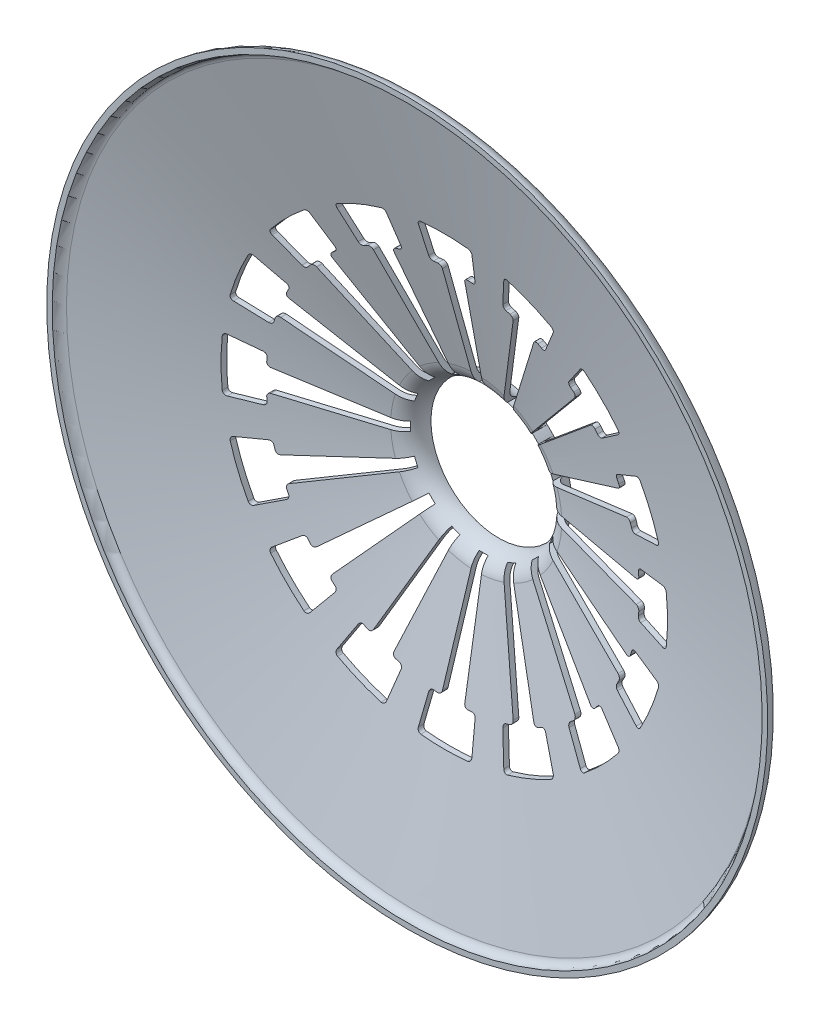
from build123d import *

# Parameters (mm, degrees)
CUT_EXTRUDE1_DEPTH = 142.525616125


with BuildPart() as part:
    # Sketch1 → Revolve4 (revolve)
    with BuildSketch(Plane(origin=(0, 0, 0), x_dir=(0, 0, -1), z_dir=(1, 0, 0))):
        with BuildLine():
            Line((0, 98.5), (0, 97))
            ThreePointArc((0, 97), (1.387336697, 96.516005618), (2.172558759, 95.2740797))
            Line((2.172558759, 95.2740797), (18.866887493, 23.372256429))
            ThreePointArc((18.866887493, 23.372256429), (21.083561831, 19.866311491), (25, 18.5))
            Line((25, 18.5), (25, 20))
            ThreePointArc((25, 20), (22.016601538, 21.04080581), (20.328020607, 23.711505636))
            Line((20.328020607, 23.711505636), (3.633691873, 95.613328906))
            ThreePointArc((3.633691873, 95.613328906), (2.320376404, 97.690499937), (0, 98.5))
        make_face()
    revolve(axis=Axis((0, 0, -25), (0, 0, 1)))

    # Sketch2 → Cut-Extrude1 (cut, through all)
    with BuildSketch(Plane(origin=(0, 0, -25), x_dir=(-1, 0, 0), z_dir=(0, 0, -1))):
        with BuildLine():
            Line((0, 0), (-49.896757575, 3.05181643))
            ThreePointArc((-49.896757575, 3.05181643), (-50.591253835, 3.394854247), (-50.832423216, 4.130950253))
            ThreePointArc((-50.832423216, 4.130950253), (-50.784252364, 4.686119062), (-50.73001839, 5.240728396))
            ThreePointArc((-50.73001839, 5.240728396), (-50.942670407, 5.966698165), (-51.60285529, 6.336033928))
            Line((-51.60285529, 6.336033928), (-59.544497306, 7.311144956))
            ThreePointArc((-59.544497306, 7.311144956), (-60.28857373, 7.101451504), (-60.660806094, 6.423908784))
            ThreePointArc((-60.660806094, 6.423908784), (-61, 0), (-60.660806094, -6.423908784))
            ThreePointArc((-60.660806094, -6.423908784), (-60.28857373, -7.101451504), (-59.544497306, -7.311144956))
            Line((-59.544497306, -7.311144956), (-51.60285529, -6.336033928))
            ThreePointArc((-51.60285529, -6.336033928), (-50.942670407, -5.966698165), (-50.73001839, -5.240728396))
            ThreePointArc((-50.73001839, -5.240728396), (-50.784252364, -4.686119062), (-50.832423216, -4.130950253))
            ThreePointArc((-50.832423216, -4.130950253), (-50.591253835, -3.394854247), (-49.896757575, -3.05181643))
            Line((-49.896757575, -3.05181643), (0, 0))
        make_face()
        with BuildLine():
            ThreePointArc((-1.220970791, 19.962695968), (0, 20), (1.220970791, 19.962695968))
            Line((1.220970791, 19.962695968), (3.05181643, 49.896757575))
            ThreePointArc((3.05181643, 49.896757575), (3.394854247, 50.591253835), (4.130950253, 50.832423216))
            ThreePointArc((4.130950253, 50.832423216), (4.686119062, 50.784252364), (5.240728396, 50.73001839))
            ThreePointArc((5.240728396, 50.73001839), (5.966698165, 50.942670407), (6.336033928, 51.60285529))
            Line((6.336033928, 51.60285529), (7.311144956, 59.544497306))
            ThreePointArc((7.311144956, 59.544497306), (7.101451504, 60.28857373), (6.423908784, 60.660806094))
            ThreePointArc((6.423908784, 60.660806094), (0, 61), (-6.423908784, 60.660806094))
            ThreePointArc((-6.423908784, 60.660806094), (-7.101451504, 60.28857373), (-7.311144956, 59.544497306))
            Line((-7.311144956, 59.544497306), (-6.336033928, 51.60285529))
            ThreePointArc((-6.336033928, 51.60285529), (-5.966698165, 50.942670407), (-5.240728396, 50.73001839))
            ThreePointArc((-5.240728396, 50.73001839), (-4.686119062, 50.784252364), (-4.130950253, 50.832423216))
            ThreePointArc((-4.130950253, 50.832423216), (-3.394854247, 50.591253835), (-3.05181643, 49.896757575))
            Line((-3.05181643, 49.896757575), (-1.220970791, 19.962695968))
        make_face()
        with BuildLine():
            ThreePointArc((6.511363089, 18.910371512), (7.653668647, 18.47759065), (8.767422936, 17.975880926))
            Line((8.767422936, 17.975880926), (21.91417319, 44.930713476))
            ThreePointArc((21.91417319, 44.930713476), (22.49687102, 45.441069467), (23.269226581, 45.382189175))
            ThreePointArc((23.269226581, 45.382189175), (23.763701493, 45.125231206), (24.255339262, 44.862885744))
            ThreePointArc((24.255339262, 44.862885744), (25.007426276, 44.781533987), (25.601289846, 45.25012661))
            Line((25.601289846, 45.25012661), (29.541309792, 52.214088289))
            ThreePointArc((29.541309792, 52.214088289), (29.632324023, 52.981771477), (29.148803331, 53.584953713))
            ThreePointArc((29.148803331, 53.584953713), (23.343689374, 56.356651483), (17.278967641, 58.501600638))
            ThreePointArc((17.278967641, 58.501600638), (16.510552632, 58.41698715), (16.032075424, 57.809796381))
            Line((16.032075424, 57.809796381), (13.893825719, 50.099517033))
            ThreePointArc((13.893825719, 50.099517033), (13.982405654, 49.348247054), (14.571735861, 48.873965605))
            ThreePointArc((14.571735861, 48.873965605), (15.104882516, 48.71183146), (15.636225803, 48.543881619))
            ThreePointArc((15.636225803, 48.543881619), (16.22399831, 48.039378418), (16.275151716, 47.266472649))
            Line((16.275151716, 47.266472649), (6.511363089, 18.910371512))
        make_face()
        with BuildLine():
            ThreePointArc((13.252400964, 14.979114416), (14.142135624, 14.142135624), (14.979114416, 13.252400964))
            Line((14.979114416, 13.252400964), (37.440295733, 33.124375548))
            ThreePointArc((37.440295733, 33.124375548), (38.173943115, 33.372894196), (38.864974097, 33.022928223))
            ThreePointArc((38.864974097, 33.022928223), (39.22347579, 32.596302658), (39.577294601, 32.165785426))
            ThreePointArc((39.577294601, 32.165785426), (40.24100043, 31.802814963), (40.96898146, 32.008476348))
            Line((40.96898146, 32.008476348), (47.274078004, 36.934557651))
            ThreePointArc((47.274078004, 36.934557651), (47.651943827, 37.608974798), (47.436056804, 38.351277878))
            ThreePointArc((47.436056804, 38.351277878), (43.133513652, 43.133513652), (38.351277878, 47.436056804))
            ThreePointArc((38.351277878, 47.436056804), (37.608974798, 47.651943827), (36.934557651, 47.274078004))
            Line((36.934557651, 47.274078004), (32.008476348, 40.96898146))
            ThreePointArc((32.008476348, 40.96898146), (31.802814963, 40.24100043), (32.165785426, 39.577294601))
            ThreePointArc((32.165785426, 39.577294601), (32.596302658, 39.22347579), (33.022928223, 38.864974097))
            ThreePointArc((33.022928223, 38.864974097), (33.372894196, 38.173943115), (33.124375548, 37.440295733))
            Line((33.124375548, 37.440295733), (13.252400964, 14.979114416))
        make_face()
        with BuildLine():
            ThreePointArc((17.975880926, 8.767422936), (18.47759065, 7.653668647), (18.910371512, 6.511363089))
            Line((18.910371512, 6.511363089), (47.266472649, 16.275151716))
            ThreePointArc((47.266472649, 16.275151716), (48.039378418, 16.22399831), (48.543881619, 15.636225803))
            ThreePointArc((48.543881619, 15.636225803), (48.71183146, 15.104882516), (48.873965605, 14.571735861))
            ThreePointArc((48.873965605, 14.571735861), (49.348247054, 13.982405654), (50.099517033, 13.893825719))
            Line((50.099517033, 13.893825719), (57.809796381, 16.032075424))
            ThreePointArc((57.809796381, 16.032075424), (58.41698715, 16.510552632), (58.501600638, 17.278967641))
            ThreePointArc((58.501600638, 17.278967641), (56.356651483, 23.343689374), (53.584953713, 29.148803331))
            ThreePointArc((53.584953713, 29.148803331), (52.981771477, 29.632324023), (52.214088289, 29.541309792))
            Line((52.214088289, 29.541309792), (45.25012661, 25.601289846))
            ThreePointArc((45.25012661, 25.601289846), (44.781533987, 25.007426276), (44.862885744, 24.255339262))
            ThreePointArc((44.862885744, 24.255339262), (45.125231206, 23.763701493), (45.382189175, 23.269226581))
            ThreePointArc((45.382189175, 23.269226581), (45.441069467, 22.49687102), (44.930713476, 21.91417319))
            Line((44.930713476, 21.91417319), (17.975880926, 8.767422936))
        make_face()
        with BuildLine():
            ThreePointArc((19.962695968, 1.220970791), (20, 0), (19.962695968, -1.220970791))
            Line((19.962695968, -1.220970791), (49.896757575, -3.05181643))
            ThreePointArc((49.896757575, -3.05181643), (50.591253835, -3.394854247), (50.832423216, -4.130950253))
            ThreePointArc((50.832423216, -4.130950253), (50.784252364, -4.686119062), (50.73001839, -5.240728396))
            ThreePointArc((50.73001839, -5.240728396), (50.942670407, -5.966698165), (51.60285529, -6.336033928))
            Line((51.60285529, -6.336033928), (59.544497306, -7.311144956))
            ThreePointArc((59.544497306, -7.311144956), (60.28857373, -7.101451504), (60.660806094, -6.423908784))
            ThreePointArc((60.660806094, -6.423908784), (61, 0), (60.660806094, 6.423908784))
            ThreePointArc((60.660806094, 6.423908784), (60.28857373, 7.101451504), (59.544497306, 7.311144956))
            Line((59.544497306, 7.311144956), (51.60285529, 6.336033928))
            ThreePointArc((51.60285529, 6.336033928), (50.942670407, 5.966698165), (50.73001839, 5.240728396))
            ThreePointArc((50.73001839, 5.240728396), (50.784252364, 4.686119062), (50.832423216, 4.130950253))
            ThreePointArc((50.832423216, 4.130950253), (50.591253835, 3.394854247), (49.896757575, 3.05181643))
            Line((49.896757575, 3.05181643), (19.962695968, 1.220970791))
        make_face()
        with BuildLine():
            ThreePointArc((18.910371512, -6.511363089), (18.47759065, -7.653668647), (17.975880926, -8.767422936))
            Line((17.975880926, -8.767422936), (44.930713476, -21.91417319))
            ThreePointArc((44.930713476, -21.91417319), (45.441069467, -22.49687102), (45.382189175, -23.269226581))
            ThreePointArc((45.382189175, -23.269226581), (45.125231206, -23.763701493), (44.862885744, -24.255339262))
            ThreePointArc((44.862885744, -24.255339262), (44.781533987, -25.007426276), (45.25012661, -25.601289846))
            Line((45.25012661, -25.601289846), (52.214088289, -29.541309792))
            ThreePointArc((52.214088289, -29.541309792), (52.981771477, -29.632324023), (53.584953713, -29.148803331))
            ThreePointArc((53.584953713, -29.148803331), (56.356651483, -23.343689374), (58.501600638, -17.278967641))
            ThreePointArc((58.501600638, -17.278967641), (58.41698715, -16.510552632), (57.809796381, -16.032075424))
            Line((57.809796381, -16.032075424), (50.099517033, -13.893825719))
            ThreePointArc((50.099517033, -13.893825719), (49.348247054, -13.982405654), (48.873965605, -14.571735861))
            ThreePointArc((48.873965605, -14.571735861), (48.71183146, -15.104882516), (48.543881619, -15.636225803))
            ThreePointArc((48.543881619, -15.636225803), (48.039378418, -16.22399831), (47.266472649, -16.275151716))
            Line((47.266472649, -16.275151716), (18.910371512, -6.511363089))
        make_face()
        with BuildLine():
            ThreePointArc((14.979114416, -13.252400964), (14.142135624, -14.142135624), (13.252400964, -14.979114416))
            Line((13.252400964, -14.979114416), (33.124375548, -37.440295733))
            ThreePointArc((33.124375548, -37.440295733), (33.372894196, -38.173943115), (33.022928223, -38.864974097))
            ThreePointArc((33.022928223, -38.864974097), (32.596302658, -39.22347579), (32.165785426, -39.577294601))
            ThreePointArc((32.165785426, -39.577294601), (31.802814963, -40.24100043), (32.008476348, -40.96898146))
            Line((32.008476348, -40.96898146), (36.934557651, -47.274078004))
            ThreePointArc((36.934557651, -47.274078004), (37.608974798, -47.651943827), (38.351277878, -47.436056804))
            ThreePointArc((38.351277878, -47.436056804), (43.133513652, -43.133513652), (47.436056804, -38.351277878))
            ThreePointArc((47.436056804, -38.351277878), (47.651943827, -37.608974798), (47.274078004, -36.934557651))
            Line((47.274078004, -36.934557651), (40.96898146, -32.008476348))
            ThreePointArc((40.96898146, -32.008476348), (40.24100043, -31.802814963), (39.577294601, -32.165785426))
            ThreePointArc((39.577294601, -32.165785426), (39.22347579, -32.596302658), (38.864974097, -33.022928223))
            ThreePointArc((38.864974097, -33.022928223), (38.173943115, -33.372894196), (37.440295733, -33.124375548))
            Line((37.440295733, -33.124375548), (14.979114416, -13.252400964))
        make_face()
        with BuildLine():
            ThreePointArc((8.767422936, -17.975880926), (7.653668647, -18.47759065), (6.511363089, -18.910371512))
            Line((6.511363089, -18.910371512), (16.275151716, -47.266472649))
            ThreePointArc((16.275151716, -47.266472649), (16.22399831, -48.039378418), (15.636225803, -48.543881619))
            ThreePointArc((15.636225803, -48.543881619), (15.104882516, -48.71183146), (14.571735861, -48.873965605))
            ThreePointArc((14.571735861, -48.873965605), (13.982405654, -49.348247054), (13.893825719, -50.099517033))
            Line((13.893825719, -50.099517033), (16.032075424, -57.809796381))
            ThreePointArc((16.032075424, -57.809796381), (16.510552632, -58.41698715), (17.278967641, -58.501600638))
            ThreePointArc((17.278967641, -58.501600638), (23.343689374, -56.356651483), (29.148803331, -53.584953713))
            ThreePointArc((29.148803331, -53.584953713), (29.632324023, -52.981771477), (29.541309792, -52.214088289))
            Line((29.541309792, -52.214088289), (25.601289846, -45.25012661))
            ThreePointArc((25.601289846, -45.25012661), (25.007426276, -44.781533987), (24.255339262, -44.862885744))
            ThreePointArc((24.255339262, -44.862885744), (23.763701493, -45.125231206), (23.269226581, -45.382189175))
            ThreePointArc((23.269226581, -45.382189175), (22.49687102, -45.441069467), (21.91417319, -44.930713476))
            Line((21.91417319, -44.930713476), (8.767422936, -17.975880926))
        make_face()
        with BuildLine():
            ThreePointArc((1.220970791, -19.962695968), (0, -20), (-1.220970791, -19.962695968))
            Line((-1.220970791, -19.962695968), (-3.05181643, -49.896757575))
            ThreePointArc((-3.05181643, -49.896757575), (-3.394854247, -50.591253835), (-4.130950253, -50.832423216))
            ThreePointArc((-4.130950253, -50.832423216), (-4.686119062, -50.784252364), (-5.240728396, -50.73001839))
            ThreePointArc((-5.240728396, -50.73001839), (-5.966698165, -50.942670407), (-6.336033928, -51.60285529))
            Line((-6.336033928, -51.60285529), (-7.311144956, -59.544497306))
            ThreePointArc((-7.311144956, -59.544497306), (-7.101451504, -60.28857373), (-6.423908784, -60.660806094))
            ThreePointArc((-6.423908784, -60.660806094), (0, -61), (6.423908784, -60.660806094))
            ThreePointArc((6.423908784, -60.660806094), (7.101451504, -60.28857373), (7.311144956, -59.544497306))
            Line((7.311144956, -59.544497306), (6.336033928, -51.60285529))
            ThreePointArc((6.336033928, -51.60285529), (5.966698165, -50.942670407), (5.240728396, -50.73001839))
            ThreePointArc((5.240728396, -50.73001839), (4.686119062, -50.784252364), (4.130950253, -50.832423216))
            ThreePointArc((4.130950253, -50.832423216), (3.394854247, -50.591253835), (3.05181643, -49.896757575))
            Line((3.05181643, -49.896757575), (1.220970791, -19.962695968))
        make_face()
        with BuildLine():
            ThreePointArc((-6.511363089, -18.910371512), (-7.653668647, -18.47759065), (-8.767422936, -17.975880926))
            Line((-8.767422936, -17.975880926), (-21.91417319, -44.930713476))
            ThreePointArc((-21.91417319, -44.930713476), (-22.49687102, -45.441069467), (-23.269226581, -45.382189175))
            ThreePointArc((-23.269226581, -45.382189175), (-23.763701493, -45.125231206), (-24.255339262, -44.862885744))
            ThreePointArc((-24.255339262, -44.862885744), (-25.007426276, -44.781533987), (-25.601289846, -45.25012661))
            Line((-25.601289846, -45.25012661), (-29.541309792, -52.214088289))
            ThreePointArc((-29.541309792, -52.214088289), (-29.632324023, -52.981771477), (-29.148803331, -53.584953713))
            ThreePointArc((-29.148803331, -53.584953713), (-23.343689374, -56.356651483), (-17.278967641, -58.501600638))
            ThreePointArc((-17.278967641, -58.501600638), (-16.510552632, -58.41698715), (-16.032075424, -57.809796381))
            Line((-16.032075424, -57.809796381), (-13.893825719, -50.099517033))
            ThreePointArc((-13.893825719, -50.099517033), (-13.982405654, -49.348247054), (-14.571735861, -48.873965605))
            ThreePointArc((-14.571735861, -48.873965605), (-15.104882516, -48.71183146), (-15.636225803, -48.543881619))
            ThreePointArc((-15.636225803, -48.543881619), (-16.22399831, -48.039378418), (-16.275151716, -47.266472649))
            Line((-16.275151716, -47.266472649), (-6.511363089, -18.910371512))
        make_face()
        with BuildLine():
            ThreePointArc((-13.252400964, -14.979114416), (-14.142135624, -14.142135624), (-14.979114416, -13.252400964))
            Line((-14.979114416, -13.252400964), (-37.440295733, -33.124375548))
            ThreePointArc((-37.440295733, -33.124375548), (-38.173943115, -33.372894196), (-38.864974097, -33.022928223))
            ThreePointArc((-38.864974097, -33.022928223), (-39.22347579, -32.596302658), (-39.577294601, -32.165785426))
            ThreePointArc((-39.577294601, -32.165785426), (-40.24100043, -31.802814963), (-40.96898146, -32.008476348))
            Line((-40.96898146, -32.008476348), (-47.274078004, -36.934557651))
            ThreePointArc((-47.274078004, -36.934557651), (-47.651943827, -37.608974798), (-47.436056804, -38.351277878))
            ThreePointArc((-47.436056804, -38.351277878), (-43.133513652, -43.133513652), (-38.351277878, -47.436056804))
            ThreePointArc((-38.351277878, -47.436056804), (-37.608974798, -47.651943827), (-36.934557651, -47.274078004))
            Line((-36.934557651, -47.274078004), (-32.008476348, -40.96898146))
            ThreePointArc((-32.008476348, -40.96898146), (-31.802814963, -40.24100043), (-32.165785426, -39.577294601))
            ThreePointArc((-32.165785426, -39.577294601), (-32.596302658, -39.22347579), (-33.022928223, -38.864974097))
            ThreePointArc((-33.022928223, -38.864974097), (-33.372894196, -38.173943115), (-33.124375548, -37.440295733))
            Line((-33.124375548, -37.440295733), (-13.252400964, -14.979114416))
        make_face()
        with BuildLine():
            ThreePointArc((-17.975880926, -8.767422936), (-18.47759065, -7.653668647), (-18.910371512, -6.511363089))
            Line((-18.910371512, -6.511363089), (-47.266472649, -16.275151716))
            ThreePointArc((-47.266472649, -16.275151716), (-48.039378418, -16.22399831), (-48.543881619, -15.636225803))
            ThreePointArc((-48.543881619, -15.636225803), (-48.71183146, -15.104882516), (-48.873965605, -14.571735861))
            ThreePointArc((-48.873965605, -14.571735861), (-49.348247054, -13.982405654), (-50.099517033, -13.893825719))
            Line((-50.099517033, -13.893825719), (-57.809796381, -16.032075424))
            ThreePointArc((-57.809796381, -16.032075424), (-58.41698715, -16.510552632), (-58.501600638, -17.278967641))
            ThreePointArc((-58.501600638, -17.278967641), (-56.356651483, -23.343689374), (-53.584953713, -29.148803331))
            ThreePointArc((-53.584953713, -29.148803331), (-52.981771477, -29.632324023), (-52.214088289, -29.541309792))
            Line((-52.214088289, -29.541309792), (-45.25012661, -25.601289846))
            ThreePointArc((-45.25012661, -25.601289846), (-44.781533987, -25.007426276), (-44.862885744, -24.255339262))
            ThreePointArc((-44.862885744, -24.255339262), (-45.125231206, -23.763701493), (-45.382189175, -23.269226581))
            ThreePointArc((-45.382189175, -23.269226581), (-45.441069467, -22.49687102), (-44.930713476, -21.91417319))
            Line((-44.930713476, -21.91417319), (-17.975880926, -8.767422936))
        make_face()
        with BuildLine():
            ThreePointArc((-18.910371512, 6.511363089), (-18.47759065, 7.653668647), (-17.975880926, 8.767422936))
            Line((-17.975880926, 8.767422936), (-44.930713476, 21.91417319))
            ThreePointArc((-44.930713476, 21.91417319), (-45.441069467, 22.49687102), (-45.382189175, 23.269226581))
            ThreePointArc((-45.382189175, 23.269226581), (-45.125231206, 23.763701493), (-44.862885744, 24.255339262))
            ThreePointArc((-44.862885744, 24.255339262), (-44.781533987, 25.007426276), (-45.25012661, 25.601289846))
            Line((-45.25012661, 25.601289846), (-52.214088289, 29.541309792))
            ThreePointArc((-52.214088289, 29.541309792), (-52.981771477, 29.632324023), (-53.584953713, 29.148803331))
            ThreePointArc((-53.584953713, 29.148803331), (-56.356651483, 23.343689374), (-58.501600638, 17.278967641))
            ThreePointArc((-58.501600638, 17.278967641), (-58.41698715, 16.510552632), (-57.809796381, 16.032075424))
            Line((-57.809796381, 16.032075424), (-50.099517033, 13.893825719))
            ThreePointArc((-50.099517033, 13.893825719), (-49.348247054, 13.982405654), (-48.873965605, 14.571735861))
            ThreePointArc((-48.873965605, 14.571735861), (-48.71183146, 15.104882516), (-48.543881619, 15.636225803))
            ThreePointArc((-48.543881619, 15.636225803), (-48.039378418, 16.22399831), (-47.266472649, 16.275151716))
            Line((-47.266472649, 16.275151716), (-18.910371512, 6.511363089))
        make_face()
        with BuildLine():
            ThreePointArc((-14.979114416, 13.252400964), (-14.142135624, 14.142135624), (-13.252400964, 14.979114416))
            Line((-13.252400964, 14.979114416), (-33.124375548, 37.440295733))
            ThreePointArc((-33.124375548, 37.440295733), (-33.372894196, 38.173943115), (-33.022928223, 38.864974097))
            ThreePointArc((-33.022928223, 38.864974097), (-32.596302658, 39.22347579), (-32.165785426, 39.577294601))
            ThreePointArc((-32.165785426, 39.577294601), (-31.802814963, 40.24100043), (-32.008476348, 40.96898146))
            Line((-32.008476348, 40.96898146), (-36.934557651, 47.274078004))
            ThreePointArc((-36.934557651, 47.274078004), (-37.608974798, 47.651943827), (-38.351277878, 47.436056804))
            ThreePointArc((-38.351277878, 47.436056804), (-43.133513652, 43.133513652), (-47.436056804, 38.351277878))
            ThreePointArc((-47.436056804, 38.351277878), (-47.651943827, 37.608974798), (-47.274078004, 36.934557651))
            Line((-47.274078004, 36.934557651), (-40.96898146, 32.008476348))
            ThreePointArc((-40.96898146, 32.008476348), (-40.24100043, 31.802814963), (-39.577294601, 32.165785426))
            ThreePointArc((-39.577294601, 32.165785426), (-39.22347579, 32.596302658), (-38.864974097, 33.022928223))
            ThreePointArc((-38.864974097, 33.022928223), (-38.173943115, 33.372894196), (-37.440295733, 33.124375548))
            Line((-37.440295733, 33.124375548), (-14.979114416, 13.252400964))
        make_face()
        with BuildLine():
            ThreePointArc((-8.767422936, 17.975880926), (-7.653668647, 18.47759065), (-6.511363089, 18.910371512))
            Line((-6.511363089, 18.910371512), (-16.275151716, 47.266472649))
            ThreePointArc((-16.275151716, 47.266472649), (-16.22399831, 48.039378418), (-15.636225803, 48.543881619))
            ThreePointArc((-15.636225803, 48.543881619), (-15.104882516, 48.71183146), (-14.571735861, 48.873965605))
            ThreePointArc((-14.571735861, 48.873965605), (-13.982405654, 49.348247054), (-13.893825719, 50.099517033))
            Line((-13.893825719, 50.099517033), (-16.032075424, 57.809796381))
            ThreePointArc((-16.032075424, 57.809796381), (-16.510552632, 58.41698715), (-17.278967641, 58.501600638))
            ThreePointArc((-17.278967641, 58.501600638), (-23.343689374, 56.356651483), (-29.148803331, 53.584953713))
            ThreePointArc((-29.148803331, 53.584953713), (-29.632324023, 52.981771477), (-29.541309792, 52.214088289))
            Line((-29.541309792, 52.214088289), (-25.601289846, 45.25012661))
            ThreePointArc((-25.601289846, 45.25012661), (-25.007426276, 44.781533987), (-24.255339262, 44.862885744))
            ThreePointArc((-24.255339262, 44.862885744), (-23.763701493, 45.125231206), (-23.269226581, 45.382189175))
            ThreePointArc((-23.269226581, 45.382189175), (-22.49687102, 45.441069467), (-21.91417319, 44.930713476))
            Line((-21.91417319, 44.930713476), (-8.767422936, 17.975880926))
        make_face()
    extrude(amount=-CUT_EXTRUDE1_DEPTH, mode=Mode.SUBTRACT)


solid = part.part
